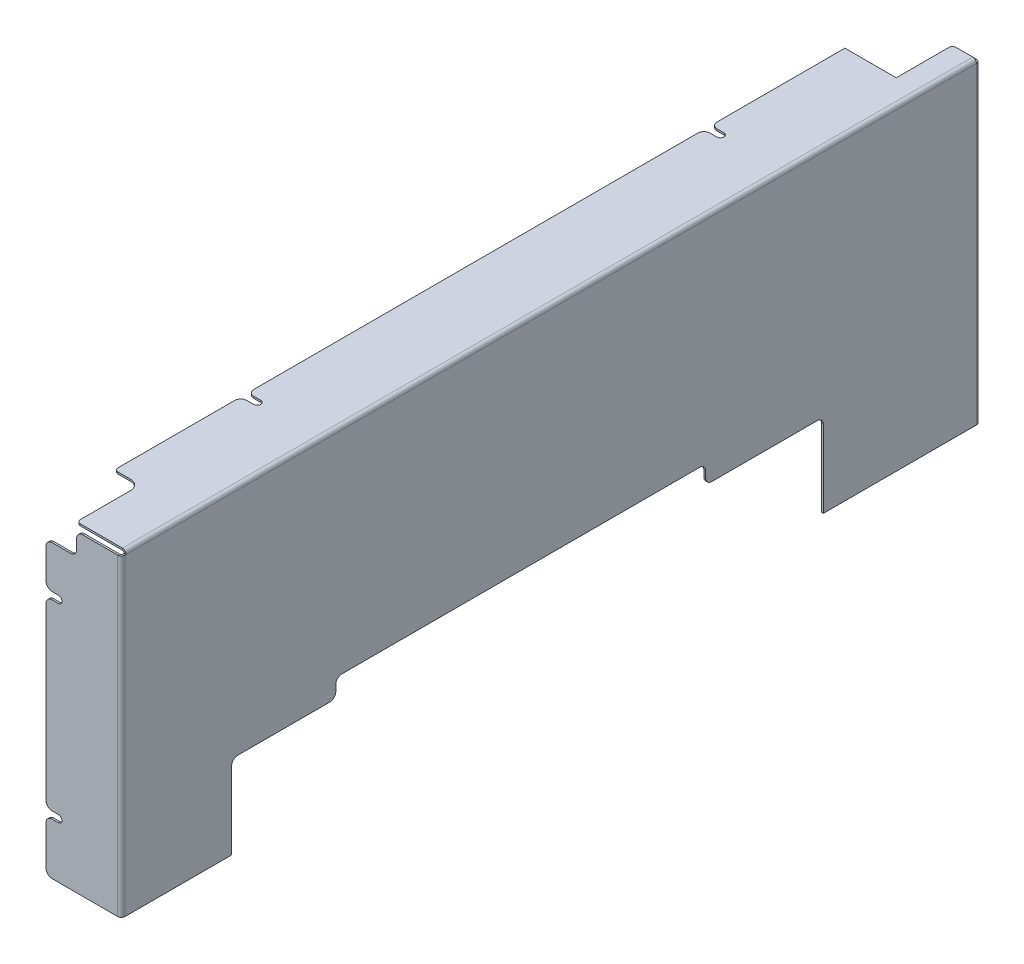
from build123d import *

# Parameters (mm, degrees)
BASE_FLANGE1_DEPTH       = 347
EDGE_FLANGE1_DEPTH       = 255.5
SKETCH5_W                = 301.8
SKETCH5_H                = 83
CUT_EXTRUDE1_DEPTH       = 10
SKETCH6_W                = 41.9
SKETCH6_H                = 45.9
CUT_EXTRUDE2_DEPTH       = 1.5
CUT_EXTRUDE3_DEPTH       = 1.5
EDGE_FLANGE2_DEPTH       = 255.5
M5_START                 = 349.3
M5_CLEARANCE_SLOT1_DEPTH = 1.5
FILLET1_R                = 5
M5_START_2               = 257
M5_CLEARANCE_SLOT2_DEPTH = 1.5
FILLET2_R                = 5
FILLET3_R                = 3
SKETCH15_W               = 96
SKETCH15_H               = 68
CUT_EXTRUDE4_DEPTH       = 10
SKETCH16_W               = 85
SKETCH16_H               = 68
CUT_EXTRUDE5_DEPTH       = 1.5
FILLET4_R                = 5
FILLET5_R                = 3
CUT_EXTRUDE6_DEPTH       = 750.483248688
CUT_EXTRUDE6_DEPTH_BACK  = 4
FILLET6_R                = 5


# Read off the part's stored shape, not the designer's step: M5 Clearance Slot1, M5 Clearance Slot2
# Sheet-metal steps are written as plain solids
with BuildPart() as part:
    # Sketch1 → Base-Flange1 (new, symmetric)
    with BuildSketch(Plane.XY):
        with BuildLine():
            Line((-61.5, 258.5), (-3, 258.5))
            ThreePointArc((-3, 258.5), (-0.878679656, 257.621320344), (0, 255.5))
            Line((0, 255.5), (0, 0))
            Line((0, 0), (-1.5, 0))
            Line((-1.5, 0), (-1.5, 255.5))
            ThreePointArc((-1.5, 255.5), (-1.939339828, 256.560660172), (-3, 257))
            Line((-3, 257), (-61.5, 257))
            Line((-61.5, 257), (-61.5, 258.5))
        make_face()
    extrude(amount=BASE_FLANGE1_DEPTH, both=True)

    # Edge-Flange1 section (across the edge) → Edge-Flange1 (add)
    with BuildSketch(Plane(origin=(-1.5, 0, 349.3), x_dir=(0, 0, -1), z_dir=(0, 1, 0))):
        with BuildLine():
            Line((-1.5, 1.5), (-1.5, 60))
            Line((-1.5, 60), (0, 60))
            Line((0, 60), (0, 1.5))
            ThreePointArc((0, 1.5), (0.439339828, 0.439339828), (1.5, 0))
            Line((1.5, 0), (2.3, 0))
            Line((2.3, 0), (2.3, -1.5))
            Line((2.3, -1.5), (1.5, -1.5))
            ThreePointArc((1.5, -1.5), (-0.621320344, -0.621320344), (-1.5, 1.5))
        make_face()
    extrude(amount=EDGE_FLANGE1_DEPTH)

    # Sketch5 → Cut-Extrude1 (cut)
    with BuildSketch(Plane(origin=(0, 0, 0), x_dir=(0, 0, -1), z_dir=(1, 0, 0))):
        with Locations((-24.9, 41.5)):
            Rectangle(SKETCH5_W, SKETCH5_H)
    extrude(amount=-CUT_EXTRUDE1_DEPTH, mode=Mode.SUBTRACT)

    # Sketch6 → Cut-Extrude2 (cut)
    with BuildSketch(Plane(origin=(0, 258.5, 0), x_dir=(1, 0, 0), z_dir=(0, 1, 0))):
        with Locations((-40.55, 324.05)):
            Rectangle(SKETCH6_W, SKETCH6_H)
    extrude(amount=-CUT_EXTRUDE2_DEPTH, mode=Mode.SUBTRACT)

    # Sketch7 → Cut-Extrude3 (cut)
    with BuildSketch(Plane(origin=(0, 258.5, 0), x_dir=(1, 0, 0), z_dir=(0, 1, 0))):
        with BuildLine():
            Line((-40.3, -335), (-40.3, -303))
            ThreePointArc((-40.3, -303), (-42.643145751, -297.343145751), (-48.3, -295))
            Line((-48.3, -295), (-71.165008453, -295))
            Line((-71.165008453, -295), (-71.165008453, -343))
            Line((-71.165008453, -343), (-71.165008453, -364.064767585))
            Line((-71.165008453, -364.064767585), (-40.3, -364.064767585))
            Line((-40.3, -364.064767585), (-40.3, -335))
        make_face()
    extrude(amount=-CUT_EXTRUDE3_DEPTH, mode=Mode.SUBTRACT)

    # Edge-Flange2 section (across the edge) → Edge-Flange2 (add)
    with BuildSketch(Plane(origin=(-1.5, 255.5, -348.5), x_dir=(0, 0, 1), z_dir=(0, -1, 0))):
        with BuildLine():
            Line((-1.5, 1.5), (-1.5, 18.1))
            Line((-1.5, 18.1), (0, 18.1))
            Line((0, 18.1), (0, 1.5))
            ThreePointArc((0, 1.5), (0.439339828, 0.439339828), (1.5, 0))
            Line((1.5, 0), (1.5, -1.5))
            ThreePointArc((1.5, -1.5), (-0.621320344, -0.621320344), (-1.5, 1.5))
        make_face()
    extrude(amount=EDGE_FLANGE2_DEPTH)

    # M5 Clearance Slot1 outline → M5 Clearance Slot1 (cut)
    with BuildSketch(Plane.XY.offset(M5_START)):
        with BuildLine():
            Line((-61.5, 42.1), (-51.4, 42.1))
            ThreePointArc((-51.4, 42.1), (-48.5, 45), (-51.4, 47.9))
            Line((-51.4, 47.9), (-61.5, 47.9))
            Line((-61.5, 47.9), (-61.5, 42.1))
        make_face()
        with BuildLine():
            Line((-61.5, 202.9), (-61.5, 197.1))
            Line((-61.5, 197.1), (-51.4, 197.1))
            ThreePointArc((-51.4, 197.1), (-48.5, 200), (-51.4, 202.9))
            Line((-51.4, 202.9), (-61.5, 202.9))
        make_face()
    extrude(amount=M5_CLEARANCE_SLOT1_DEPTH, mode=Mode.SUBTRACT)

    # Fillet1
    fillet1_edges = [part.edges().sort_by_distance(p)[0] for p in [
        (-61.5, 42.1, 350.05),
        (-61.5, 47.9, 350.05),
        (-61.5, 197.1, 350.05),
        (-61.5, 202.9, 350.05),
        (-61.5, 0, 350.05),
        (-61.5, 255.5, 350.05),
    ]]
    fillet(fillet1_edges, radius=FILLET1_R)

    # M5 Clearance Slot2 outline → M5 Clearance Slot2 (cut)
    with BuildSketch(Plane(origin=(0, 0, 0), x_dir=(1, 0, 0), z_dir=(0, 1, 0)).offset(M5_START_2)):
        with BuildLine():
            Line((-51, 191.9), (-61.2, 191.9))
            ThreePointArc((-61.2, 191.9), (-61.350201599, 191.896107643), (-61.5, 191.88444102))
            Line((-61.5, 191.88444102), (-61.5, 186.11555898))
            ThreePointArc((-61.5, 186.11555898), (-61.350201599, 186.103892357), (-61.2, 186.1))
            Line((-61.2, 186.1), (-51, 186.1))
            ThreePointArc((-51, 186.1), (-48.1, 189), (-51, 191.9))
        make_face()
        with BuildLine():
            ThreePointArc((-61.2, -186.1), (-61.350201599, -186.103892357), (-61.5, -186.11555898))
            Line((-61.5, -186.11555898), (-61.5, -191.88444102))
            ThreePointArc((-61.5, -191.88444102), (-61.350201599, -191.896107643), (-61.2, -191.9))
            Line((-61.2, -191.9), (-51, -191.9))
            ThreePointArc((-51, -191.9), (-48.1, -189), (-51, -186.1))
            Line((-51, -186.1), (-61.2, -186.1))
        make_face()
    extrude(amount=M5_CLEARANCE_SLOT2_DEPTH, mode=Mode.SUBTRACT)

    # Fillet2
    fillet2_edges = [part.edges().sort_by_distance(p)[0] for p in [
        (-61.5, 257.75, 186.11555898),
        (-61.5, 257.75, 191.88444102),
        (-61.5, 257.75, -191.88444102),
        (-61.5, 257.75, -186.11555898),
    ]]
    fillet(fillet2_edges, radius=FILLET2_R)

    # Fillet3
    fillet3_edges = [part.edges().sort_by_distance(p)[0] for p in [
        (-19.6, 255.5, -349.25),
        (-19.6, 0, -349.25),
        (-19.6, 257.75, -347),
    ]]
    fillet(fillet3_edges, radius=FILLET3_R)

    # Sketch15 → Cut-Extrude4 (cut)
    with BuildSketch(Plane(origin=(0, 0, 0), x_dir=(0, 0, -1), z_dir=(1, 0, 0))):
        with Locations((174, 34)):
            Rectangle(SKETCH15_W, SKETCH15_H)
    extrude(amount=-CUT_EXTRUDE4_DEPTH, mode=Mode.SUBTRACT)

    # Sketch16 → Cut-Extrude5 (cut)
    with BuildSketch(Plane(origin=(0, 0, 0), x_dir=(0, 0, -1), z_dir=(1, 0, 0))):
        with Locations((-218.3, 34)):
            Rectangle(SKETCH16_W, SKETCH16_H)
    extrude(amount=-CUT_EXTRUDE5_DEPTH, mode=Mode.SUBTRACT)

    # Fillet4
    fillet4_edges = [part.edges().sort_by_distance(p)[0] for p in [
        (-0.75, 68, -126),
        (-0.75, 68, -222),
        (-0.75, 68, 175.8),
        (-0.75, 68, 260.8),
        (-0.75, 83, 175.8),
        (-0.75, 83, -126),
    ]]
    fillet(fillet4_edges, radius=FILLET4_R)

    # Fillet5
    fillet5_edges = [part.edges().sort_by_distance(p)[0] for p in [
        (-40.3, 257.75, 347),
        (-61.5, 257.75, 295),
    ]]
    fillet(fillet5_edges, radius=FILLET5_R)

    # Sketch17 → Cut-Extrude6 (cut, two sides: drawn at the far end of the back side and taken through both)
    with BuildSketch(Plane.XY.offset(350.8).offset(-CUT_EXTRUDE6_DEPTH_BACK)):
        with BuildLine():
            Line((-61.5, 250.5), (-61.5, 237.5))
            Line((-61.5, 237.5), (-41.5, 237.5))
            ThreePointArc((-41.5, 237.5), (-37.964466094, 238.964466094), (-36.5, 242.5))
            Line((-36.5, 242.5), (-36.5, 255.5))
            Line((-36.5, 255.5), (-56.5, 255.5))
            ThreePointArc((-56.5, 255.5), (-60.035533906, 254.035533906), (-61.5, 250.5))
        make_face()
    extrude(amount=CUT_EXTRUDE6_DEPTH + CUT_EXTRUDE6_DEPTH_BACK, mode=Mode.SUBTRACT)

    # Fillet6
    fillet6_edges = [part.edges().sort_by_distance(p)[0] for p in [
        (-61.5, 237.5, 350.05),
        (-36.5, 255.5, 350.05),
    ]]
    fillet(fillet6_edges, radius=FILLET6_R)


solid = part.part
